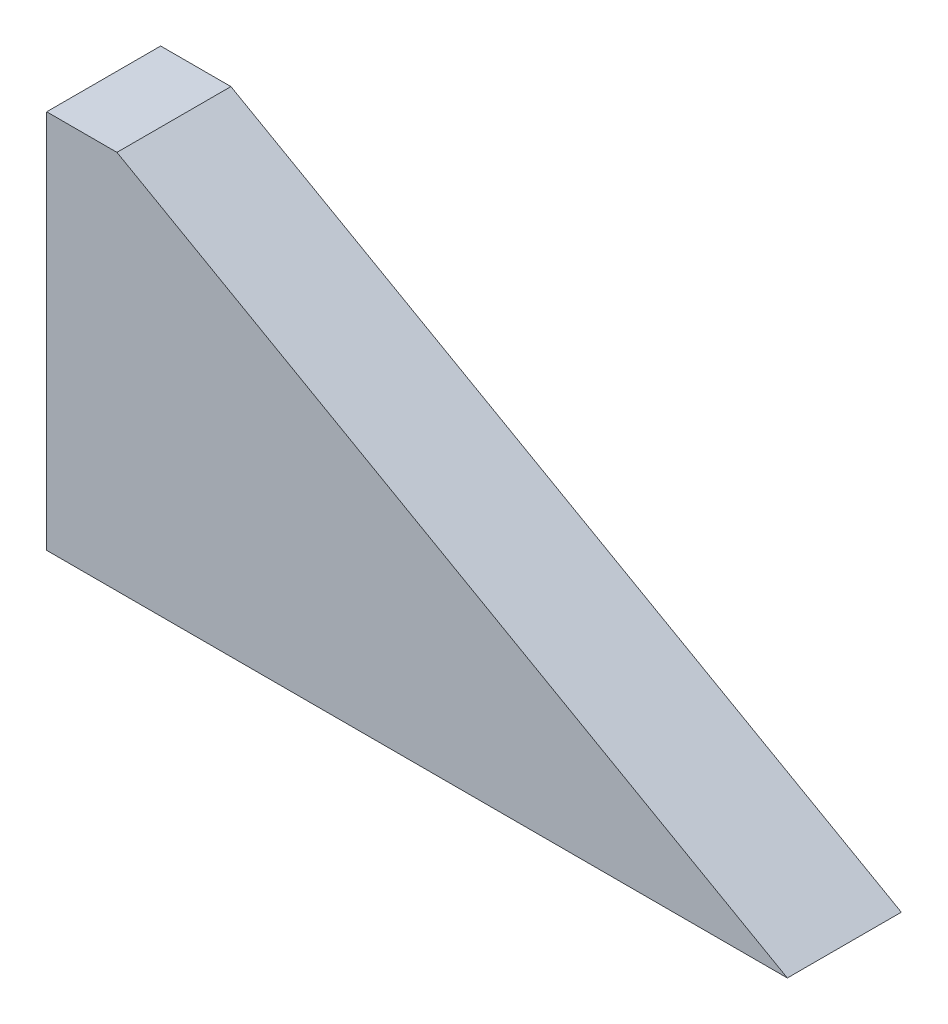
from build123d import *

# Parameters (mm, degrees)
EXTRUDE_1_DEPTH = 6


with BuildPart() as part:
    # Эскиз1 → Бобышка-Вытянуть1 (new body)
    with BuildSketch(Plane.XY):
        Polygon((6, 6.078379342), (6, 26.078379342), (9.7, 26.078379342), (45, 6.078379342), align=None)
    extrude(amount=-EXTRUDE_1_DEPTH)


solid = part.part
